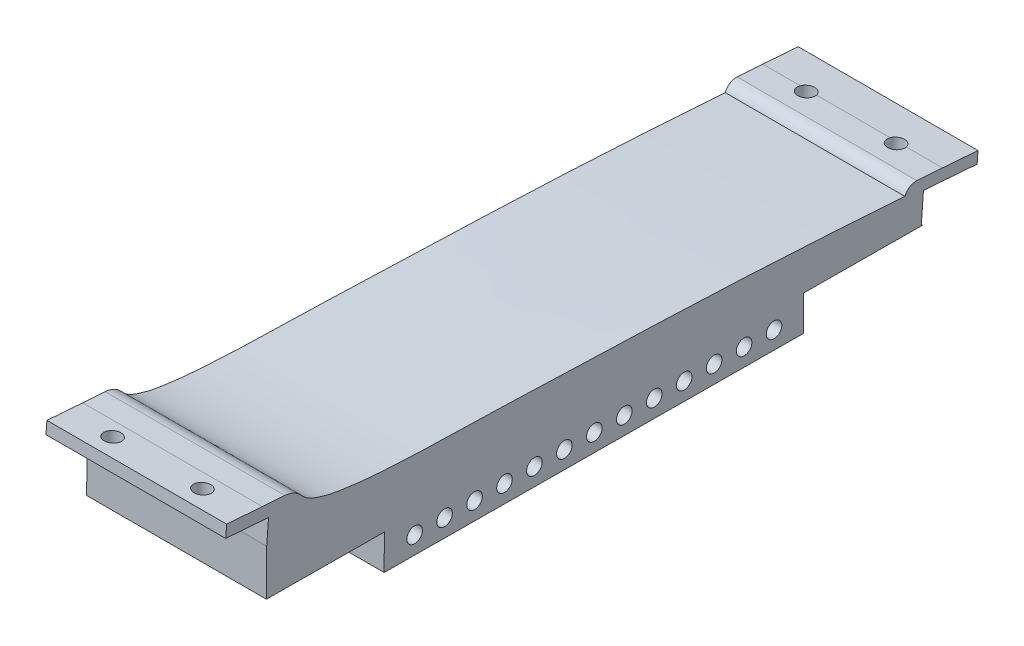
from build123d import *

# Parameters (mm, degrees)
BOSS_EXTRUDE1_DEPTH     = 38.1
BODY_MOVE_COPY1_ANGLE   = 76
CUT_EXTRUDE2_DEPTH      = 27.686
CUT_EXTRUDE2_DEPTH_BACK = 19.304
SKETCH2_R               = 1.778
SKETCH3_R               = 1.651
BOSS_EXTRUDE3_DEPTH     = 38.1
CUT_EXTRUDE3_DEPTH      = 166.624
FILLET1_R               = 2.54
FILLET2_R               = 5.08


# Read off the part's stored shape, not the designer's step: Boss-Extrude1
with BuildPart() as part:
    # Boss-Extrude1 outline → Boss-Extrude1 (new body)
    with BuildSketch(Plane.YZ):
        with BuildLine():
            Line((-177.728966577, -19.612387901), (-179.328344067, -24.431507082))
            Line((-179.328344067, -24.431507082), (-181.74053638, -33.853637228))
            Line((-181.74053638, -33.853637228), (-46.997797731, -68.349594436))
            Line((-46.997797731, -68.349594436), (-47.243300219, -68.268116651))
            Line((-47.243300219, -68.268116651), (-45.261934692, -62.29802099))
            Line((-45.261934692, -62.29802099), (-34.437621483, -65.890412514))
            Line((-34.437621483, -65.890412514), (-33.676428359, -63.596844917))
            Line((-33.676428359, -63.596844917), (-40.844223574, -61.217984819))
            Line((-40.844223574, -61.217984819), (-49.689813808, -58.356136896))
            ThreePointArc((-49.689813808, -58.356136896), (-49.090331053, -59.35599157), (-48.875674694, -60.501858749))
            add(Edge.make_bspline(
                [(-48.875674694, -60.501858749), (-51.481588454, -59.650228313), (-54.086868244, -58.796574008), (-59.306851094, -57.119204745), (-61.920752248, -56.292940091), (-69.763922716, -53.818806344), (-74.998887821, -52.189030982), (-85.492693344, -49.005324606), (-90.749742978, -47.448465456), (-101.277848082, -44.38376061), (-106.549611901, -42.878231151), (-114.450647678, -40.596944828), (-117.083573714, -39.833898355), (-122.352548817, -38.318668592), (-124.989189983, -37.568544873), (-130.266296073, -36.081598037), (-132.906309917, -35.343205879), (-136.865659916, -34.23328444), (-138.1853692, -33.863053056), (-140.825807818, -33.126138436), (-142.146927925, -32.760814475), (-144.789004976, -32.029599004), (-146.109574353, -31.662359376), (-148.744756003, -30.907158856), (-150.059463325, -30.518782697), (-152.68086793, -29.721123567), (-153.988134138, -29.312872306), (-156.592980259, -28.469810183), (-157.88998705, -28.03342783), (-160.465343266, -27.109505047), (-161.743719366, -26.622037757), (-163.642262511, -25.838681655), (-164.271562301, -25.567834624), (-165.516256976, -24.988013622), (-166.133118191, -24.67816116), (-167.33978346, -24.006676565), (-167.926659769, -23.647090611), (-168.773723405, -23.059534384), (-169.051212007, -22.856632019), (-169.57988303, -22.412712124), (-169.833034377, -22.168598337), (-170.286870827, -21.643070876), (-170.489857207, -21.36306094), (-170.751061, -20.91185985), (-170.83115985, -20.755045284), (-170.969655024, -20.434844168), (-171.028288966, -20.271370644), (-171.119427156, -19.936119702), (-171.152098942, -19.762485455), (-171.182322897, -19.414060755), (-171.180095887, -19.240431177), (-171.157349079, -19.064171214), (-171.156914923, -19.060865581), (-171.156473253, -19.057560102)],
                knots=[0.503868919, 0.503868919, 0.503868919, 0.503868919, 0.535118919, 0.535118919, 0.566368919, 0.566368919, 0.628868919, 0.628868919, 0.691368919, 0.691368919, 0.753868919, 0.753868919, 0.785118919, 0.785118919, 0.816368919, 0.816368919, 0.847618919, 0.847618919, 0.863243919, 0.863243919, 0.878868919, 0.878868919, 0.894493919, 0.894493919, 0.910118919, 0.910118919, 0.925743919, 0.925743919, 0.941368919, 0.941368919, 0.956993919, 0.956993919, 0.964806419, 0.964806419, 0.972618919, 0.972618919, 0.980431419, 0.980431419, 0.984337669, 0.984337669, 0.988243919, 0.988243919, 0.992150169, 0.992150169, 0.994103294, 0.994103294, 0.996056419, 0.996056419, 0.998009544, 0.998009544, 0.999962669, 0.999962669, 1, 1, 1, 1], degree=3))
            Line((-171.156473253, -19.057560102), (-178.330380798, -16.736558127))
            Line((-178.330380798, -16.736558127), (-185.562490855, -14.33635311))
            Line((-185.562490855, -14.33635311), (-186.362559194, -16.747056462))
            Line((-186.362559194, -16.747056462), (-177.728966577, -19.612387901))
        make_face()
    extrude(amount=BOSS_EXTRUDE1_DEPTH)


with BuildPart() as part_1:
    # Body-Move/Copy1: moved
    add(part.part.rotate(Axis((0, -110.019493776, -41.342973773), (-1, 0, 0)), BODY_MOVE_COPY1_ANGLE))

    # Sketch2 → Cut-Extrude2 (cut, two sides: drawn at the far end of the back side and taken through both)
    with BuildSketch(Plane(origin=(0, -106.950854273, 8.154430993), x_dir=(-1, 0, 0), z_dir=(0, -0.9971059878983162, 0.07602400211330035)).offset(-CUT_EXTRUDE2_DEPTH_BACK)):
        with Locations(Location((-9.664935336, -26.346486151, 0), (0, 0, 90))):
            Circle(SKETCH2_R)
        with Locations(Location((-28.714935336, -26.346486151, 0), (0, 0, 90))):
            Circle(SKETCH2_R)
        with Locations(Location((-9.664935336, 121.045997452, 0), (0, 0, 14.853623258))):
            Circle(SKETCH2_R)
        with Locations(Location((-28.714935336, 121.045997452, 0), (0, 0, 14.853623258))):
            Circle(SKETCH2_R)
    extrude(amount=CUT_EXTRUDE2_DEPTH + CUT_EXTRUDE2_DEPTH_BACK, mode=Mode.SUBTRACT)

    # Sketch3 → Boss-Extrude3 (add)
    with BuildSketch(Plane(origin=(38.1, 0, 0), x_dir=(0, 0, -1), z_dir=(1, 0, 0))):
        Polygon((83.849210714, -120.804548445), (-5.049105738, -120.257436024), (-5.094785299, -127.679742536), (83.803531153, -128.226854957), align=None)
        with Locations((45.815838144, -124.253547051)):
            Circle(SKETCH3_R, mode=Mode.SUBTRACT)
        with Locations((52.16571789, -124.292626509)):
            Circle(SKETCH3_R, mode=Mode.SUBTRACT)
        with Locations((58.515597637, -124.331705968)):
            Circle(SKETCH3_R, mode=Mode.SUBTRACT)
        with Locations((64.865477383, -124.370785427)):
            Circle(SKETCH3_R, mode=Mode.SUBTRACT)
        with Locations((71.21535713, -124.409864885)):
            Circle(SKETCH3_R, mode=Mode.SUBTRACT)
        with Locations((77.565236876, -124.448944344)):
            Circle(SKETCH3_R, mode=Mode.SUBTRACT)
        with Locations((1.366679918, -123.97999084)):
            Circle(SKETCH3_R, mode=Mode.SUBTRACT)
        with Locations((7.716559664, -124.019070299)):
            Circle(SKETCH3_R, mode=Mode.SUBTRACT)
        with Locations((14.066439411, -124.058149757)):
            Circle(SKETCH3_R, mode=Mode.SUBTRACT)
        with Locations((20.416319157, -124.097229216)):
            Circle(SKETCH3_R, mode=Mode.SUBTRACT)
        with Locations((26.766198904, -124.136308675)):
            Circle(SKETCH3_R, mode=Mode.SUBTRACT)
        with Locations((33.11607865, -124.175388133)):
            Circle(SKETCH3_R, mode=Mode.SUBTRACT)
        with Locations((39.465958397, -124.214467592)):
            Circle(SKETCH3_R, mode=Mode.SUBTRACT)
    extrude(amount=-BOSS_EXTRUDE3_DEPTH)

    # Sketch5 → Cut-Extrude3 (cut)
    with BuildSketch(Plane(origin=(0, 0.026518129, 4.30883474), x_dir=(1, 0, 0), z_dir=(0, 0.006154245457488319, 0.9999810624521093))):
        Polygon((19.05, -127.708679154), (16.383, -127.708679154), (16.383, -120.088679154), (21.717, -120.088679154), (21.717, -127.708679154), align=None)
    extrude(amount=-CUT_EXTRUDE3_DEPTH, mode=Mode.SUBTRACT)

    # Fillet1
    # the kernel refuses this fillet: 2.54 mm, written as the material it takes off along each edge
    with BuildSketch(Plane(origin=(-9.655358388, -111.932222707, -103.996461086), x_dir=(0, -0.06850546019731428, -0.9976507414537183), z_dir=(1, 0, 0))) as fillet1_piece_1:
        with BuildLine():
            CenterArc((3.862143355, -2.54), FILLET1_R, 90, 72.847679606)
            Line((1.435112117, -1.790920986), (1.386571492, -1.775939406))
            ThreePointArc((1.386571492, -1.775939406), (0.838510743, -0.798536321), (-0.026132425, -0.043563016))
            Line((-0.026132425, -0.043563016), (0, 0.0508))
            Line((0, 0.0508), (3.862143355, 0.0508))
            Line((3.862143355, 0.0508), (3.862143355, 0))
        make_face()
    extrude(amount=57.410716775, mode=Mode.SUBTRACT)

    # Fillet2
    fillet2_edges = [part_1.edges().sort_by_distance(p)[0] for p in [
        (19.05, -103.1864261, 23.36930565),
    ]]
    fillet(fillet2_edges, radius=FILLET2_R)


solid = part_1.part
